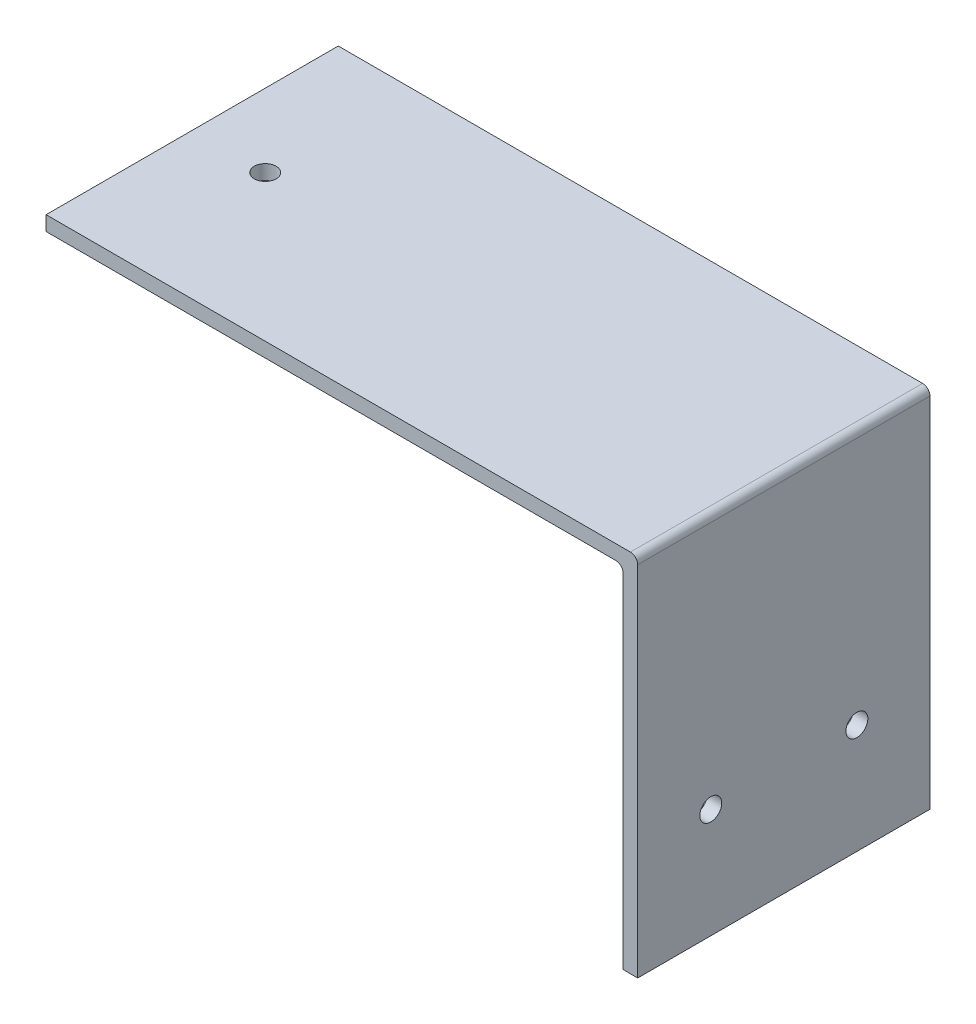
from build123d import *

# Parameters (mm, degrees)
SKETCH1_W           = 80
SKETCH1_H           = 40
SKETCH1_R           = 1.5
BOSS_EXTRUDE1_DEPTH = 2
SKETCH2_W           = 2
SKETCH2_H           = 40
BOSS_EXTRUDE2_DEPTH = 50
SKETCH3_R           = 1.5
CUT_EXTRUDE1_DEPTH  = 70
FILLET1_R           = 1


with BuildPart() as part:
    # Sketch1 → Boss-Extrude1 (new body)
    with BuildSketch(Plane(origin=(0, 0, 0), x_dir=(1, 0, 0), z_dir=(0, 1, 0))):
        with Locations((40, 20)):
            Rectangle(SKETCH1_W, SKETCH1_H)
        with Locations((10, 20)):
            Circle(SKETCH1_R, mode=Mode.SUBTRACT)
    extrude(amount=BOSS_EXTRUDE1_DEPTH)

    # Sketch2 → Boss-Extrude2 (add)
    with BuildSketch(Plane(origin=(0, 2, 0), x_dir=(1, 0, 0), z_dir=(0, 1, 0))):
        with Locations((80, 20)):
            Rectangle(SKETCH2_W, SKETCH2_H)
    extrude(amount=-BOSS_EXTRUDE2_DEPTH)

    # Sketch3 → Cut-Extrude1 (cut)
    with BuildSketch(Plane.ZY.offset(-79)):
        with Locations((-30, -33)):
            Circle(SKETCH3_R)
        with Locations((-10, -33)):
            Circle(SKETCH3_R)
    extrude(amount=-CUT_EXTRUDE1_DEPTH, mode=Mode.SUBTRACT)

    # Fillet1
    fillet1_edges = [part.edges().sort_by_distance(p)[0] for p in [
        (79, 0, -20),
        (81, 2, -20),
    ]]
    fillet(fillet1_edges, radius=FILLET1_R)


solid = part.part
